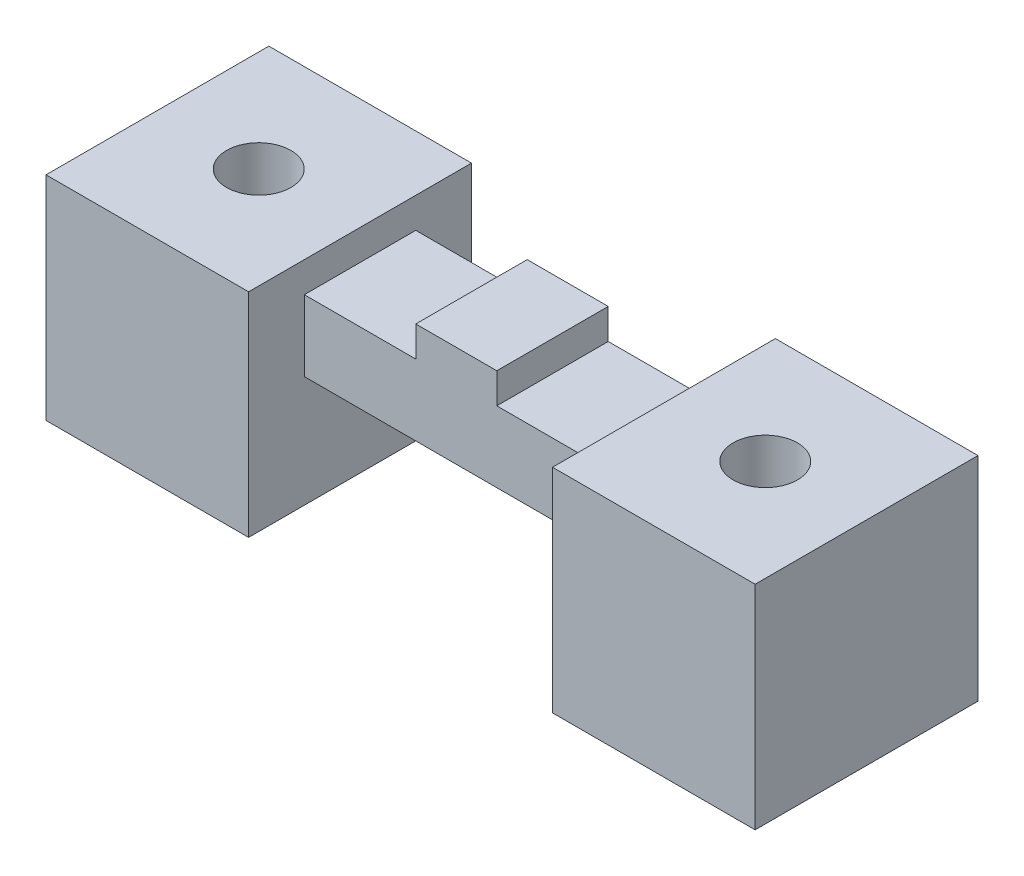
from build123d import *

# Parameters (mm, degrees)
SKETCH1_W           = 70
SKETCH1_H           = 22
BOSS_EXTRUDE1_DEPTH = 21
SKETCH2_W           = 30
SKETCH2_H           = 22
CUT_EXTRUDE2_DEPTH  = 11
SKETCH3_R           = 3.175
CUT_EXTRUDE3_DEPTH  = 22
SKETCH4_W           = 30
SKETCH4_H           = 5.5
CUT_EXTRUDE4_DEPTH  = 11
SKETCH5_W           = 11
SKETCH5_H           = 11
CUT_EXTRUDE5_DEPTH  = 3


with BuildPart() as part:
    # Sketch1 → Boss-Extrude1 (new body)
    with BuildSketch(Plane(origin=(0, 0, 0), x_dir=(1, 0, 0), z_dir=(0, 1, 0))):
        Rectangle(SKETCH1_W, SKETCH1_H)
    extrude(amount=-BOSS_EXTRUDE1_DEPTH)

    # Sketch2 → Cut-Extrude2 (cut)
    with BuildSketch(Plane.XZ.offset(21)):
        Rectangle(SKETCH2_W, SKETCH2_H)
    extrude(amount=-CUT_EXTRUDE2_DEPTH, mode=Mode.SUBTRACT)

    # Sketch3 → Cut-Extrude3 (cut)
    with BuildSketch(Plane.XZ.offset(21)):
        with Locations((-25, 0)):
            Circle(SKETCH3_R)
        with Locations((25, 0)):
            Circle(SKETCH3_R)
    extrude(amount=-CUT_EXTRUDE3_DEPTH, mode=Mode.SUBTRACT)

    # Sketch4 → Cut-Extrude4 (cut)
    with BuildSketch(Plane(origin=(0, 0, 0), x_dir=(1, 0, 0), z_dir=(0, 1, 0))):
        with Locations((0, 8.25)):
            Rectangle(SKETCH4_W, SKETCH4_H)
        with Locations((0, -8.25)):
            Rectangle(SKETCH4_W, SKETCH4_H)
    extrude(amount=-CUT_EXTRUDE4_DEPTH, mode=Mode.SUBTRACT)

    # Sketch5 → Cut-Extrude5 (cut)
    with BuildSketch(Plane(origin=(0, 0, 0), x_dir=(1, 0, 0), z_dir=(0, 1, 0))):
        with Locations((-9.5, 0)):
            Rectangle(SKETCH5_W, SKETCH5_H)
        with Locations((9.5, 0)):
            Rectangle(SKETCH5_W, SKETCH5_H)
    extrude(amount=-CUT_EXTRUDE5_DEPTH, mode=Mode.SUBTRACT)


solid = part.part
